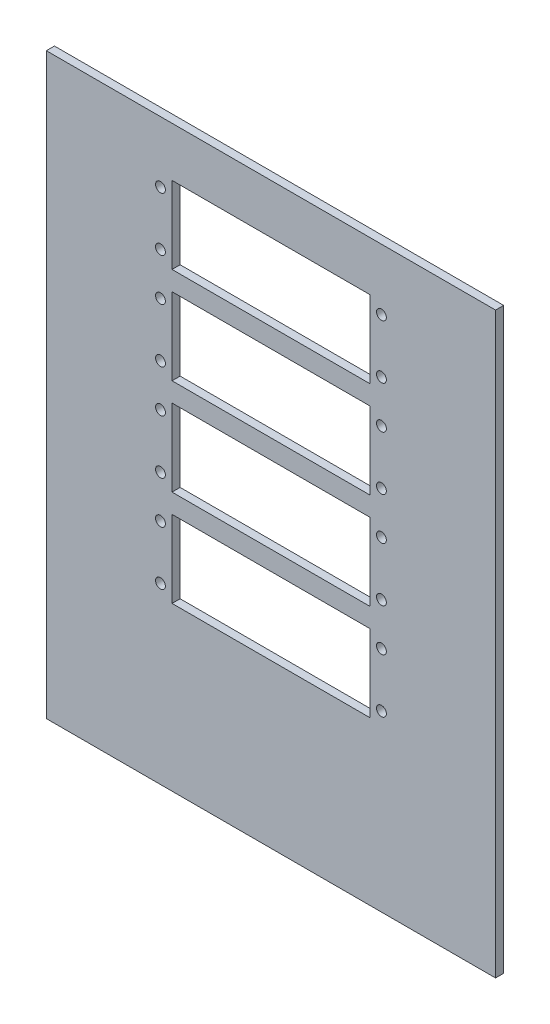
from build123d import *

# Parameters (mm, degrees)
ESQUISSE1_W                  = 233
ESQUISSE1_H                  = 300
BOSS_EXTRU_1_DEPTH           = 4.2
ENL_V_MAT_EXTRU_1_DEPTH      = 238.323218733
ENL_V_MAT_EXTRU_1_DEPTH_BACK = 238.323218733
ESQUISSE2_R                  = 2.55
ESQUISSE2_W                  = 102.6
ESQUISSE2_H                  = 40


with BuildPart() as part:
    # Esquisse1 → Boss.-Extru.1 (new body)
    with BuildSketch(Plane.XY):
        with Locations((-45.332061069, 23.536895674)):
            Rectangle(ESQUISSE1_W, ESQUISSE1_H)
    extrude(amount=BOSS_EXTRU_1_DEPTH)

    # Esquisse2 → Enlèv. mat.-Extru.1 (cut, two sides: drawn at the far end of the back side and taken through both)
    with BuildSketch(Plane.XY.offset(4.2).offset(-ENL_V_MAT_EXTRU_1_DEPTH_BACK)):
        with Locations((-102.632061069, -8.123104326)):
            Circle(ESQUISSE2_R)
        with Locations((11.967938931, -8.123104326)):
            Circle(ESQUISSE2_R)
        with Locations((-102.632061069, 41.876895674)):
            Circle(ESQUISSE2_R)
        with Locations((11.967938931, 41.876895674)):
            Circle(ESQUISSE2_R)
        with Locations((-102.632061069, 91.876895674)):
            Circle(ESQUISSE2_R)
        with Locations((11.967938931, 91.876895674)):
            Circle(ESQUISSE2_R)
        with Locations((-102.632061069, 141.876895674)):
            Circle(ESQUISSE2_R)
        with Locations((11.967938931, 141.876895674)):
            Circle(ESQUISSE2_R)
        with Locations((-102.632061069, 113.876895674)):
            Circle(ESQUISSE2_R)
        with Locations((11.967938931, 113.876895674)):
            Circle(ESQUISSE2_R)
        with Locations((-102.632061069, 63.876895674)):
            Circle(ESQUISSE2_R)
        with Locations((11.967938931, 63.876895674)):
            Circle(ESQUISSE2_R)
        with Locations((-102.632061069, 13.876895674)):
            Circle(ESQUISSE2_R)
        with Locations((11.967938931, 13.876895674)):
            Circle(ESQUISSE2_R)
        with Locations((-102.632061069, -36.123104326)):
            Circle(ESQUISSE2_R)
        with Locations((11.967938931, -36.123104326)):
            Circle(ESQUISSE2_R)
        with Locations((-45.332061069, -22.123104326)):
            Rectangle(ESQUISSE2_W, ESQUISSE2_H)
        with Locations((-45.332061069, 27.876895674)):
            Rectangle(ESQUISSE2_W, ESQUISSE2_H)
        with Locations((-45.332061069, 77.876895674)):
            Rectangle(ESQUISSE2_W, ESQUISSE2_H)
        with Locations((-45.332061069, 127.876895674)):
            Rectangle(ESQUISSE2_W, ESQUISSE2_H)
    extrude(amount=ENL_V_MAT_EXTRU_1_DEPTH + ENL_V_MAT_EXTRU_1_DEPTH_BACK, mode=Mode.SUBTRACT)


solid = part.part
